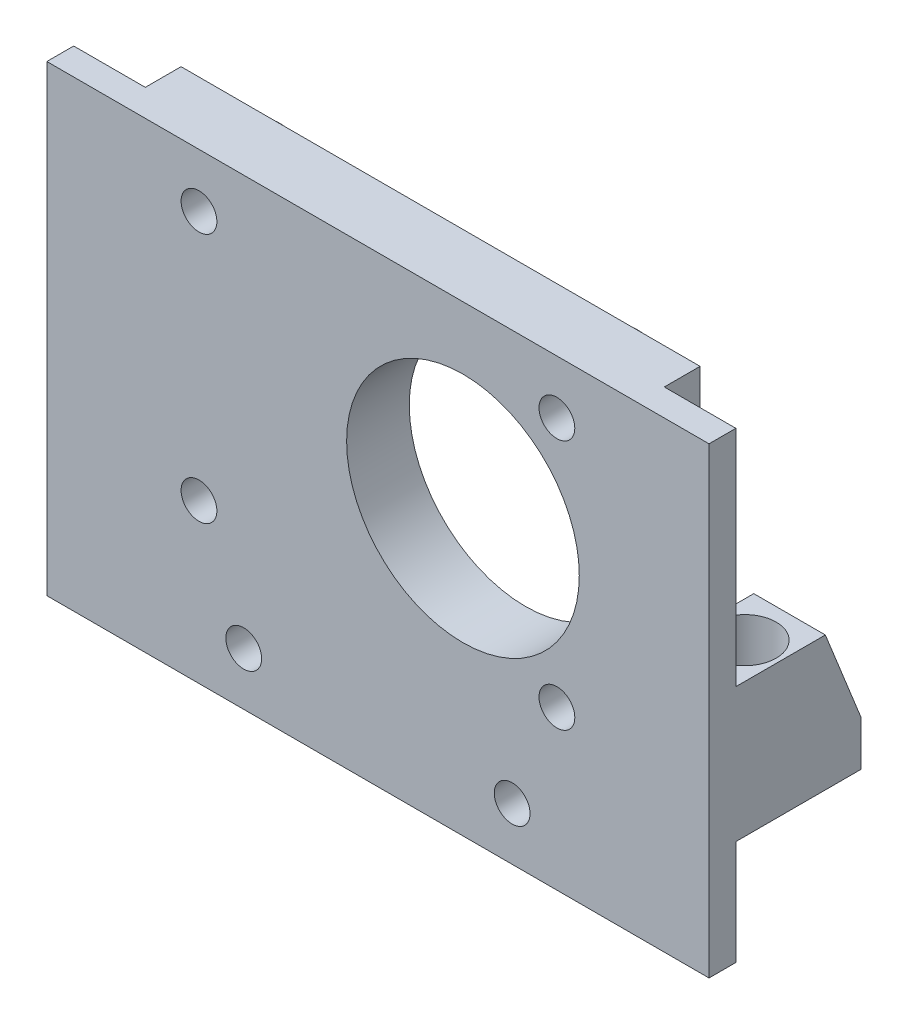
from build123d import *
from build123d.topology import SkipClean

# Parameters (mm, degrees)
SKETCH1_R               = 4
SKETCH1_R_2             = 2
BOSS_EXTRUDE2_DEPTH     = 6.038447986
BOSS_EXTRUDE2_2_DEPTH   = 6.038447986
BOSS_EXTRUDE2_3_DEPTH   = 6.038447986
BOSS_EXTRUDE2_4_DEPTH   = 6.038447986
SKETCH3_W               = 74
SKETCH3_H               = 51.7
BOSS_EXTRUDE4_DEPTH     = 3
BOSS_EXTRUDE3_START     = 11.7
SKETCH2_W               = 8
SKETCH2_H               = 8
SKETCH2_R               = 2
SKETCH2_H_2             = 14
BOSS_EXTRUDE3_DEPTH     = 5
SKETCH1_4_R             = 2
SKETCH1_4_R_2           = 13
CUT_EXTRUDE1_DEPTH      = 10
BOSS_EXTRUDE5_DEPTH     = 8
BOSS_EXTRUDE7_DEPTH     = 8
SKETCH2_2_R             = 2
CUT_EXTRUDE2_DEPTH      = 85.324276113
CUT_EXTRUDE3_START      = -6
SKETCH5_R               = 3.5
SKETCH5_R_2             = 3
CUT_EXTRUDE3_DEPTH      = 72.702596752
BOSS_EXTRUDE8_START     = -4
SKETCH3_3_W             = 58
SKETCH3_3_H             = 35
SKETCH3_3_R             = 4
SKETCH3_3_W_2           = 74
SKETCH3_3_H_2           = 5
BOSS_EXTRUDE8_DEPTH     = 4
CUT_EXTRUDE5_DEPTH      = 79.663462115
CUT_EXTRUDE5_DEPTH_BACK = 79.663462115
SKETCH1_6_R             = 13
SKETCH8_W               = 8
SKETCH8_H               = 14
SKETCH8_H_2             = 11.313736344
CUT_EXTRUDE6_DEPTH      = 25
BOSS_EXTRUDE10_START    = -8
SKETCH9_W               = 10
SKETCH9_H               = 5
BOSS_EXTRUDE10_DEPTH    = 8
SKETCH2_3_R             = 2
CUT_EXTRUDE7_DEPTH      = 25
SKETCH10_R              = 2
CUT_EXTRUDE8_DEPTH      = 25
SKETCH2_4_R             = 2
CUT_EXTRUDE9_DEPTH      = 25
SKETCH1_7_R             = 2
CUT_EXTRUDE10_DEPTH     = 25


with BuildPart() as part:
    # Sketch1 → Boss-Extrude2 (new body)
    with BuildSketch(Plane.XY):
        with Locations((49, 35.83595021)):
            Circle(SKETCH1_R)
        with Locations((49, 35.83595021)):
            Circle(SKETCH1_R_2, mode=Mode.SUBTRACT)
    extrude(amount=BOSS_EXTRUDE2_DEPTH)



with BuildPart() as body_2:
    # Sketch1 → Boss-Extrude2 2 (new body)
    with BuildSketch(Plane.XY):
        with Locations((49, 7.83595021)):
            Circle(SKETCH1_R)
        with Locations((49, 7.83595021)):
            Circle(SKETCH1_R_2, mode=Mode.SUBTRACT)
    extrude(amount=BOSS_EXTRUDE2_2_DEPTH)


with BuildPart() as body_3:
    # Sketch1 → Boss-Extrude2 3 (new body)
    with BuildSketch(Plane.XY):
        with Locations((9, 7.83595021)):
            Circle(SKETCH1_R)
        with Locations((9, 7.83595021)):
            Circle(SKETCH1_R_2, mode=Mode.SUBTRACT)
    extrude(amount=BOSS_EXTRUDE2_3_DEPTH)


with BuildPart() as body_4:
    # Sketch1 → Boss-Extrude2 4 (new body)
    with BuildSketch(Plane.XY):
        with Locations((9, 35.83595021)):
            Circle(SKETCH1_R)
        with Locations((9, 35.83595021)):
            Circle(SKETCH1_R_2, mode=Mode.SUBTRACT)
    extrude(amount=BOSS_EXTRUDE2_4_DEPTH)


with BuildPart() as part_1:
    add(part.part)

    add(body_2.part)  # Boss-Extrude4 merges body 2

    add(body_3.part)  # Boss-Extrude4 merges body 3

    add(body_4.part)  # Boss-Extrude4 merges body 4
    # Sketch3 → Boss-Extrude4 (add)
    with BuildSketch(Plane.XY.offset(6.038447986)):
        with Locations((29, 15.98595021)):
            Rectangle(SKETCH3_W, SKETCH3_H)
    extrude(amount=BOSS_EXTRUDE4_DEPTH)

    # Sketch2 → Boss-Extrude3 (add)
    # profile 1 of 2: a face of its own
    with BuildSketch(Plane(origin=(0, -9.86404979, 0), x_dir=(1, 0, 0), z_dir=(0, 1, 0)).offset(BOSS_EXTRUDE3_START)):
        with Locations((-4, -2.038447986)):
            Rectangle(SKETCH2_W, SKETCH2_H)
        with Locations(Location((-4, -1.038447986, 0), (0, 0, 270))):
            Circle(SKETCH2_R, mode=Mode.SUBTRACT)
    # profile 2 of 2: a face of its own
    with BuildSketch(Plane(origin=(0, -9.86404979, 0), x_dir=(1, 0, 0), z_dir=(0, 1, 0)).offset(BOSS_EXTRUDE3_START)):
        with Locations((62, 0.961552014)):
            Rectangle(SKETCH2_W, SKETCH2_H_2)
        with Locations(Location((62, -1.038447986, 0), (0, 0, 270))):
            Circle(SKETCH2_R, mode=Mode.SUBTRACT)
    extrude(amount=BOSS_EXTRUDE3_DEPTH)

    # Sketch1<4> → Cut-Extrude1 (cut)
    with BuildSketch(Plane.XY):
        with Locations((9, 35.83595021)):
            Circle(SKETCH1_4_R)
        with Locations((9, 7.83595021)):
            Circle(SKETCH1_4_R)
        with Locations((49, 35.83595021)):
            Circle(SKETCH1_4_R)
        with Locations((38.5, 21.83595021)):
            Circle(SKETCH1_4_R_2)
        with Locations((49, 7.83595021)):
            Circle(SKETCH1_4_R)
    extrude(amount=CUT_EXTRUDE1_DEPTH, mode=Mode.SUBTRACT)

    # Sketch4 → Boss-Extrude5 (add)
    with BuildSketch(Plane(origin=(66, 0, 0), x_dir=(0, 0, -1), z_dir=(1, 0, 0))):
        Polygon((7.961552014, 6.83595021), (-6.038447986, 41.83595021), (-6.038447986, 6.83595021), align=None)
    extrude(amount=-BOSS_EXTRUDE5_DEPTH)

    # Sketch6 → Boss-Extrude7 (add)
    with BuildSketch(Plane.ZY.offset(8)):
        Polygon((-1.961552014, 6.83595021), (6.038447986, 14.993789145), (6.038447986, 6.83595021), align=None)
    extrude(amount=-BOSS_EXTRUDE7_DEPTH)

    # Sketch2<2> → Cut-Extrude2 (cut, through all)
    with SkipClean():  # the faces are left unmerged after this step: merging them gives an invalid solid
        with BuildSketch(Plane(origin=(0, -9.86404979, 0), x_dir=(1, 0, 0), z_dir=(0, 1, 0))):
            with Locations(Location((62, -1.038447986, 0), (0, 0, 90))):
                Circle(SKETCH2_2_R)
            with Locations(Location((-4, -1.038447986, 0), (0, 0, 90))):
                Circle(SKETCH2_2_R)
        extrude(amount=CUT_EXTRUDE2_DEPTH, mode=Mode.SUBTRACT)
    add(part_1.part.scale(1), mode=Mode.REPLACE)  # the faces are merged on a copy

    # Sketch5 → Cut-Extrude3 (cut, through all)
    with SkipClean():  # the faces are left unmerged after this step: merging them gives an invalid solid
        with BuildSketch(Plane.XZ.offset(-1.83595021).offset(CUT_EXTRUDE3_START)):
            with Locations(Location((62, 1.038447986, 0), (0, 0, 270))):
                Circle(SKETCH5_R)
            with Locations((-4, 1.038447986)):
                Circle(SKETCH5_R_2)
        extrude(amount=-CUT_EXTRUDE3_DEPTH, mode=Mode.SUBTRACT)

    # Sketch3<3> → Boss-Extrude8 (add)
    # profile 1 of 2: a face of its own
    with BuildSketch(Plane.XY.offset(6.038447986).offset(BOSS_EXTRUDE8_START)):
        with Locations((29, 24.33595021)):
            Rectangle(SKETCH3_3_W, SKETCH3_3_H)
        with Locations((49, 35.83595021)):
            Circle(SKETCH3_3_R, mode=Mode.SUBTRACT)
    # profile 2 of 2: a face of its own
    with BuildSketch(Plane.XY.offset(6.038447986).offset(BOSS_EXTRUDE8_START)):
        with Locations((29, 4.33595021)):
            Rectangle(SKETCH3_3_W_2, SKETCH3_3_H_2)
    extrude(amount=BOSS_EXTRUDE8_DEPTH)

    # Sketch1<6> → Cut-Extrude5 (cut, two sides: drawn at the far end of the back side and taken through both)
    with BuildSketch(Plane.XY.offset(-CUT_EXTRUDE5_DEPTH_BACK)):
        with Locations((38.5, 21.83595021)):
            Circle(SKETCH1_6_R)
    extrude(amount=CUT_EXTRUDE5_DEPTH + CUT_EXTRUDE5_DEPTH_BACK, mode=Mode.SUBTRACT)

    # Sketch8 → Cut-Extrude6 (cut)
    with BuildSketch(Plane(origin=(0, 41.83595021, 0), x_dir=(1, 0, 0), z_dir=(0, 1, 0))):
        with Locations((62, 0.961552014)):
            Rectangle(SKETCH8_W, SKETCH8_H)
        with Locations((-4, -0.381579814)):
            Rectangle(SKETCH8_W, SKETCH8_H_2)
    extrude(amount=-CUT_EXTRUDE6_DEPTH, mode=Mode.SUBTRACT)

    # Sketch9 → Boss-Extrude10 (add)
    with BuildSketch(Plane.ZY.offset(8).offset(BOSS_EXTRUDE10_START)):
        with Locations((1.038447986, 4.33595021)):
            Rectangle(SKETCH9_W, SKETCH9_H)
    extrude(amount=BOSS_EXTRUDE10_DEPTH)

    # Sketch2<3> → Cut-Extrude7 (cut)
    with BuildSketch(Plane(origin=(0, -9.86404979, 0), x_dir=(1, 0, 0), z_dir=(0, 1, 0))):
        with Locations(Location((-4, -1.038447986, 0), (0, 0, 90))):
            Circle(SKETCH2_3_R)
    extrude(amount=CUT_EXTRUDE7_DEPTH, mode=Mode.SUBTRACT)

    # Sketch10 → Cut-Extrude8 (cut)
    with BuildSketch(Plane.XY.offset(9.038447986)):
        with Locations((44, -3.96404979)):
            Circle(SKETCH10_R)
        with Locations((14, -3.96404979)):
            Circle(SKETCH10_R)
    extrude(amount=-CUT_EXTRUDE8_DEPTH, mode=Mode.SUBTRACT)

    # Sketch2<4> → Cut-Extrude9 (cut)
    with BuildSketch(Plane(origin=(0, -9.86404979, 0), x_dir=(1, 0, 0), z_dir=(0, 1, 0))):
        with Locations(Location((62, -1.038447986, 0), (0, 0, 90))):
            Circle(SKETCH2_4_R)
    extrude(amount=CUT_EXTRUDE9_DEPTH, mode=Mode.SUBTRACT)

    # Sketch1<7> → Cut-Extrude10 (cut)
    with BuildSketch(Plane.XY):
        with Locations((9, 35.83595021)):
            Circle(SKETCH1_7_R)
        with Locations((9, 7.83595021)):
            Circle(SKETCH1_7_R)
        with Locations((49, 35.83595021)):
            Circle(SKETCH1_7_R)
        with Locations((49, 7.83595021)):
            Circle(SKETCH1_7_R)
    extrude(amount=CUT_EXTRUDE10_DEPTH, mode=Mode.SUBTRACT)


solid = part_1.part
